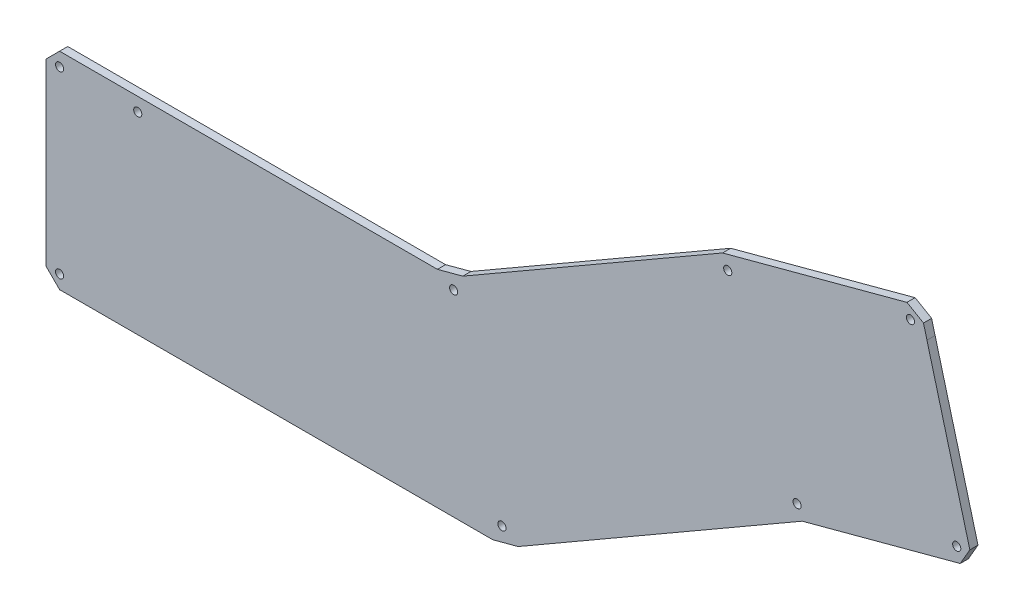
from build123d import *

# Parameters (mm, degrees)
ESQUISSE1_R        = 1.5
BOSS_EXTRU_1_DEPTH = 3


with BuildPart() as part:
    # Esquisse1 → Boss.-Extru.1 (new body)
    with BuildSketch(Plane.XY):
        Polygon((-76.753762562, 49.085106383), (-95.753762562, 49.085106383), (-100.753762562, 44.085106383), (-100.753762562, 35.79522772), (-100.753762562, -21.914893617), (-95.753762562, -26.914893617), (63.668725862, -26.914893617), (72.998852881, -24.414893617), (177.550794817, 35.948198204), (235.687735127, 51.52594441), (239.223269033, 57.649668767), (228.094050093, 99.184479298), (223.435307281, 116.571144171), (222.169064525, 121.408322556), (216.073234813, 124.951244602), (211.187858568, 123.642211983), (148.215889778, 106.7689238), (52.634714257, 51.585106383), (43.304587238, 49.085106383), (-75.988646329, 49.085106383), align=None)
        with Locations((-95.753762562, 44.085106383)):
            Circle(ESQUISSE1_R, mode=Mode.SUBTRACT)
        with Locations((-95.753762562, -21.914893617)):
            Circle(ESQUISSE1_R, mode=Mode.SUBTRACT)
        with Locations((67.039694146, -20.835264486)):
            Circle(ESQUISSE1_R, mode=Mode.SUBTRACT)
        with Locations((49.263745973, 45.505477252)):
            Circle(ESQUISSE1_R, mode=Mode.SUBTRACT)
        with Locations((175.637377655, 40.567595866)):
            Circle(ESQUISSE1_R, mode=Mode.SUBTRACT)
        with Locations((150.12930694, 102.149526137)):
            Circle(ESQUISSE1_R, mode=Mode.SUBTRACT)
        with Locations((234.393639901, 56.355573542)):
            Circle(ESQUISSE1_R, mode=Mode.SUBTRACT)
        with Locations((217.363403759, 120.120565138)):
            Circle(ESQUISSE1_R, mode=Mode.SUBTRACT)
        with Locations((-66.988646329, 44.085106383)):
            Circle(ESQUISSE1_R, mode=Mode.SUBTRACT)
    extrude(amount=BOSS_EXTRU_1_DEPTH)


solid = part.part
